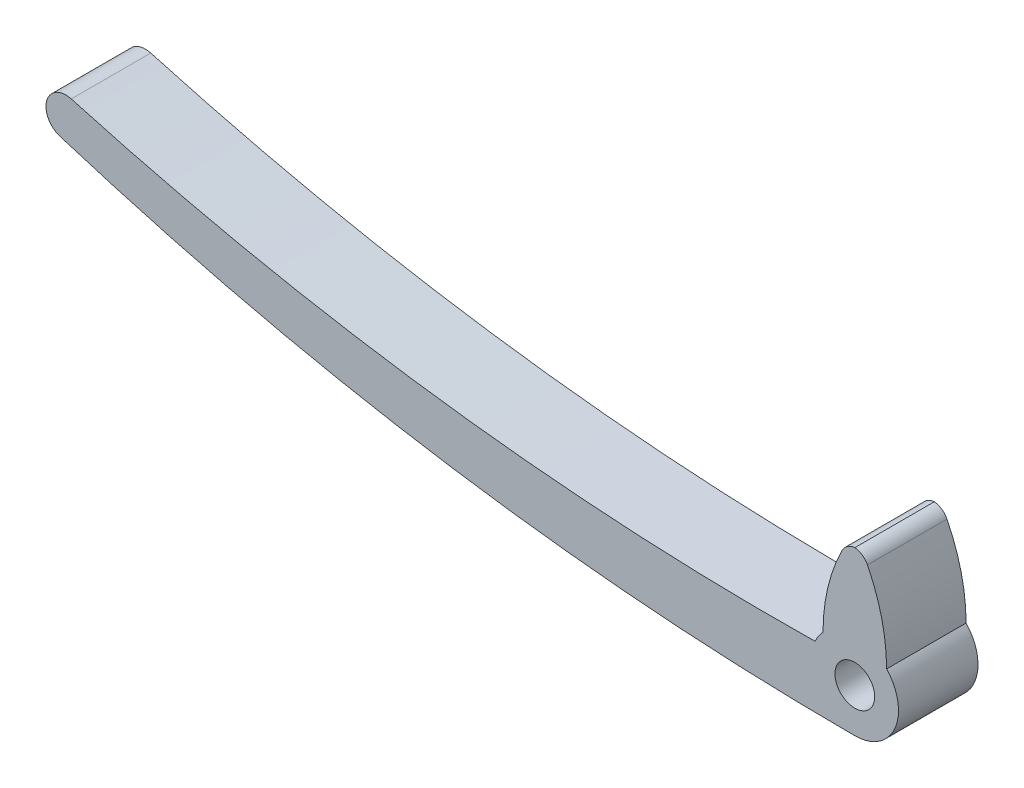
from build123d import *

# Parameters (mm, degrees)
SKETCH2_R           = 2.5
BOSS_EXTRUDE1_DEPTH = 5
FILLET1_R           = 2


with BuildPart() as part:
    # Sketch2 → Boss-Extrude1 (new, symmetric)
    with BuildSketch(Plane.XY):
        with BuildLine():
            Line((-1, 15), (1, 15))
            ThreePointArc((1, 15), (3.237065366, 9.584445672), (4, 3.774917218))
            ThreePointArc((4, 3.774917218), (5.050348735, -2.178067412), (0, -5.5))
            ThreePointArc((0, -5.5), (-50.58302006, -1.652596692), (-100.002221288, 9.801091818))
            ThreePointArc((-100.002221288, 9.801091818), (-101.650418114, 12.901978174), (-98.572266253, 14.592253326))
            ThreePointArc((-98.572266253, 14.592253326), (-52.235024066, 5.027100207), (-5, 2.291287847))
            ThreePointArc((-5, 2.291287847), (-4.560733387, 3.074038219), (-4, 3.774917218))
            ThreePointArc((-4, 3.774917218), (-3.237065366, 9.584445672), (-1, 15))
        make_face()
        Circle(SKETCH2_R, mode=Mode.SUBTRACT)
    extrude(amount=BOSS_EXTRUDE1_DEPTH, both=True)

    # Fillet1
    # the kernel refuses this fillet: 2 mm, written as the material it takes off along each edge
    with BuildSketch(Plane(origin=(1, 15, 8.124355519), x_dir=(0.4746222349820919, -0.8801896011999936, 0), z_dir=(0, 0, -1))) as fillet1_piece_1:
        with BuildLine():
            CenterArc((1.194199131, 1.999228593), FILLET1_R, 208.334756637, 63.256639898)
            Line((-0.566180071, 1.049984123), (0, 0))
            ThreePointArc((0, 0), (0.624871104, -0.00867849), (1.249742207, 0))
        make_face()
    extrude(amount=16.248711037, mode=Mode.SUBTRACT)
    with BuildSketch(Plane(origin=(-1, 15, 8.124355519), x_dir=(1, 0, 0), z_dir=(0, 0, -1))) as fillet1_piece_2:
        with BuildLine():
            CenterArc((1.192906757, 2), FILLET1_R, 206.743360102, 63.256639898)
            ThreePointArc((-0.59315544, 1.100010095), (-0.304216436, 0.545886044), (0, 0))
            Line((0, 0), (1.192906757, 0))
        make_face()
    extrude(amount=16.248711037, mode=Mode.SUBTRACT)


solid = part.part
